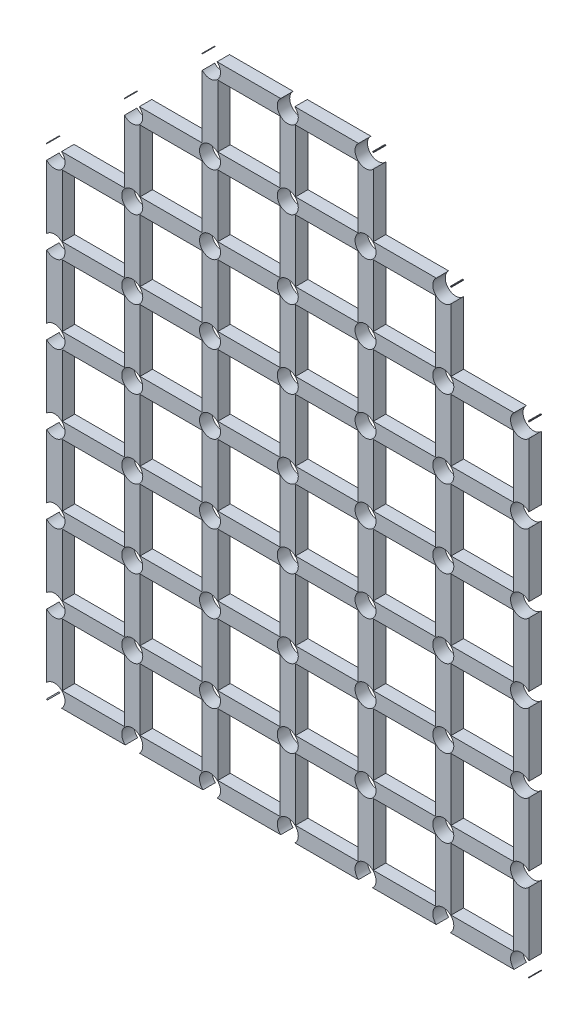
from build123d import *

# Parameters (mm, degrees)
SKETCH_1_W             = 15
SKETCH_1_H             = 0.5
EXTRUDE_1_DEPTH        = 0.4
PATTERN_LINEAR_1_COUNT = 7
PATTERN_LINEAR_1_PITCH = 2.5
EXTRUDE_3_DEPTH        = 0.4
PATTERN_LINEAR_2_COUNT = 7
PATTERN_LINEAR_2_PITCH = 2.5
SKETCH_4_W             = 0.5
SKETCH_4_H             = 2.5
EXTRUDE_4_DEPTH        = 0.4
SKETCH_6_W             = 0.5
SKETCH_6_H             = 2.5
EXTRUDE_6_DEPTH        = 0.4
SKETCH_7_W             = 10.5
SKETCH_7_H             = 0.5
SKETCH_7_W_2           = 5.5
EXTRUDE_7_DEPTH        = 0.4
OTHER_2_OUTLINE_R      = 0.3375
OTHER_2_DEPTH          = 0.4


# Read off the part's stored shape, not the designer's step: 型腔2
with BuildPart() as part:
    # 草图1 → 凸台-拉伸1 (new body)
    with BuildSketch(Plane.XY):
        with Locations((7.5, 0.25)):
            Rectangle(SKETCH_1_W, SKETCH_1_H)
    extrude(amount=EXTRUDE_1_DEPTH)


with BuildPart() as pattern_linear_1_1:
    # 阵列(线性)1: pattern copy
    add(part.part.moved(Location(Vector(0, 1, 0) * (1 * PATTERN_LINEAR_1_PITCH))))


with BuildPart() as pattern_linear_1_2:
    # 阵列(线性)1: pattern copy
    add(part.part.moved(Location(Vector(0, 1, 0) * (2 * PATTERN_LINEAR_1_PITCH))))


with BuildPart() as pattern_linear_1_3:
    # 阵列(线性)1: pattern copy
    add(part.part.moved(Location(Vector(0, 1, 0) * (3 * PATTERN_LINEAR_1_PITCH))))


with BuildPart() as pattern_linear_1_4:
    # 阵列(线性)1: pattern copy
    add(part.part.moved(Location(Vector(0, 1, 0) * (4 * PATTERN_LINEAR_1_PITCH))))


with BuildPart() as pattern_linear_1_5:
    # 阵列(线性)1: pattern copy
    add(part.part.moved(Location(Vector(0, 1, 0) * (5 * PATTERN_LINEAR_1_PITCH))))


with BuildPart() as pattern_linear_1_6:
    # 阵列(线性)1: pattern copy
    add(part.part.moved(Location(Vector(0, 1, 0) * (6 * PATTERN_LINEAR_1_PITCH))))


with BuildPart() as part_1:
    add(part.part)

    add(pattern_linear_1_1.part)  # 凸台-拉伸3 merges 阵列(线性)1_1

    add(pattern_linear_1_2.part)  # 凸台-拉伸3 merges 阵列(线性)1_2

    add(pattern_linear_1_3.part)  # 凸台-拉伸3 merges 阵列(线性)1_3
    # 草图3 → 凸台-拉伸3 (add)
    with BuildSketch(Plane.XY.offset(0.4)):
        Polygon((0, 15.5), (0, 8), (0, 0), (-0.5, 0), (-0.5, 10.98507125), (-0.5, 15.5), align=None)
    extrude_3 = extrude(amount=-EXTRUDE_3_DEPTH)

    # 阵列(线性)2: 凸台-拉伸3 ×7
    with Locations(*[(i * PATTERN_LINEAR_2_PITCH, 0, 0) for i in range(1, PATTERN_LINEAR_2_COUNT)]):
        add(extrude_3)

    add(pattern_linear_1_6.part)  # 凸台-拉伸4 merges 阵列(线性)1_6
    # 草图4 → 凸台-拉伸4 (add)
    with BuildSketch(Plane.XY.offset(0.4)):
        with Locations((4.75, 16.75)):
            Rectangle(SKETCH_4_W, SKETCH_4_H)
        with Locations((2.25, 16.75)):
            Rectangle(SKETCH_4_W, SKETCH_4_H)
        with Locations((7.25, 16.75)):
            Rectangle(SKETCH_4_W, SKETCH_4_H)
        with Locations((9.75, 16.75)):
            Rectangle(SKETCH_4_W, SKETCH_4_H)
        with Locations((12.25, 16.75)):
            Rectangle(SKETCH_4_W, SKETCH_4_H)
    extrude(amount=-EXTRUDE_4_DEPTH)

    # 草图6 → 凸台-拉伸6 (add)
    with BuildSketch(Plane.XY.offset(0.4)):
        with Locations((4.75, 19.25)):
            Rectangle(SKETCH_6_W, SKETCH_6_H)
        with Locations((9.75, 19.25)):
            Rectangle(SKETCH_6_W, SKETCH_6_H)
        with Locations((7.25, 19.25)):
            Rectangle(SKETCH_6_W, SKETCH_6_H)
    extrude(amount=-EXTRUDE_6_DEPTH)

    # 草图7 → 凸台-拉伸7 (add)
    with BuildSketch(Plane.XY.offset(0.4)):
        with Locations((7.25, 17.75)):
            Rectangle(SKETCH_7_W, SKETCH_7_H)
        with Locations((7.25, 20.25)):
            Rectangle(SKETCH_7_W_2, SKETCH_7_H)
    extrude(amount=-EXTRUDE_7_DEPTH)

    # Combine 1: union 阵列(线性)1_5, 阵列(线性)1_4
    add(pattern_linear_1_5.part)
    add(pattern_linear_1_4.part)

    # 型腔2 outline → 型腔2 (cut)
    with BuildSketch(Plane.XY):
        with BuildLine():
            ThreePointArc((9.523270536, 20.5), (9.511351461, 20.011351461), (10, 20.023270536))
            Line((10, 20.023270536), (10, 20.476729464))
            ThreePointArc((10, 20.476729464), (9.988648539, 20.488648539), (9.976729464, 20.5))
            Line((9.976729464, 20.5), (9.523270536, 20.5))
        make_face()
        with BuildLine():
            ThreePointArc((7.023270536, 20.5), (7.25, 19.9125), (7.476729464, 20.5))
            Line((7.476729464, 20.5), (7.023270536, 20.5))
        make_face()
        with BuildLine():
            Line((12.476729464, 18), (12.023270536, 18))
            ThreePointArc((12.023270536, 18), (12.011351461, 17.511351461), (12.5, 17.523270536))
            Line((12.5, 17.523270536), (12.5, 17.976729464))
            ThreePointArc((12.5, 17.976729464), (12.488648539, 17.988648539), (12.476729464, 18))
        make_face()
        with BuildLine():
            ThreePointArc((4.5, 20.023270536), (4.988648539, 20.011351461), (4.976729464, 20.5))
            Line((4.976729464, 20.5), (4.523270536, 20.5))
            ThreePointArc((4.523270536, 20.5), (4.511351461, 20.488648539), (4.5, 20.476729464))
            Line((4.5, 20.476729464), (4.5, 20.023270536))
        make_face()
        with BuildLine():
            Line((14.976729464, 15.5), (14.523270536, 15.5))
            ThreePointArc((14.523270536, 15.5), (14.511351461, 15.011351461), (15, 15.023270536))
            Line((15, 15.023270536), (15, 15.476729464))
            ThreePointArc((15, 15.476729464), (14.988648539, 15.488648539), (14.976729464, 15.5))
        make_face()
        with BuildLine():
            ThreePointArc((2, 17.523270536), (2.488648539, 17.511351461), (2.476729464, 18))
            Line((2.476729464, 18), (2.023270536, 18))
            ThreePointArc((2.023270536, 18), (2.011351461, 17.988648539), (2, 17.976729464))
            Line((2, 17.976729464), (2, 17.523270536))
        make_face()
        with BuildLine():
            Line((15, 12.523270536), (15, 12.976729464))
            ThreePointArc((15, 12.976729464), (14.4125, 12.75), (15, 12.523270536))
        make_face()
        with BuildLine():
            Line((15, 10.023270536), (15, 10.476729464))
            ThreePointArc((15, 10.476729464), (14.4125, 10.25), (15, 10.023270536))
        make_face()
        with BuildLine():
            ThreePointArc((-0.5, 15.023270536), (-0.011351461, 15.011351461), (-0.023270536, 15.5))
            Line((-0.023270536, 15.5), (-0.476729464, 15.5))
            ThreePointArc((-0.476729464, 15.5), (-0.488648539, 15.488648539), (-0.5, 15.476729464))
            Line((-0.5, 15.476729464), (-0.5, 15.023270536))
        make_face()
        with BuildLine():
            Line((15, 7.523270536), (15, 7.976729464))
            ThreePointArc((15, 7.976729464), (14.4125, 7.75), (15, 7.523270536))
        make_face()
        with BuildLine():
            ThreePointArc((-0.5, 12.523270536), (0.0875, 12.75), (-0.5, 12.976729464))
            Line((-0.5, 12.976729464), (-0.5, 12.523270536))
        make_face()
        with BuildLine():
            Line((15, 5.023270536), (15, 5.476729464))
            ThreePointArc((15, 5.476729464), (14.4125, 5.25), (15, 5.023270536))
        make_face()
        with BuildLine():
            ThreePointArc((-0.5, 10.023270536), (0.0875, 10.25), (-0.5, 10.476729464))
            Line((-0.5, 10.476729464), (-0.5, 10.023270536))
        make_face()
        with BuildLine():
            Line((15, 2.523270536), (15, 2.976729464))
            ThreePointArc((15, 2.976729464), (14.4125, 2.75), (15, 2.523270536))
        make_face()
        with BuildLine():
            ThreePointArc((-0.5, 7.523270536), (0.0875, 7.75), (-0.5, 7.976729464))
            Line((-0.5, 7.976729464), (-0.5, 7.523270536))
        make_face()
        with BuildLine():
            Line((15, 0.023270536), (15, 0.476729464))
            ThreePointArc((15, 0.476729464), (14.511351461, 0.488648539), (14.523270536, 0))
            Line((14.523270536, 0), (14.976729464, 0))
            ThreePointArc((14.976729464, 0), (14.988648539, 0.011351461), (15, 0.023270536))
        make_face()
        with BuildLine():
            ThreePointArc((-0.5, 5.023270536), (0.0875, 5.25), (-0.5, 5.476729464))
            Line((-0.5, 5.476729464), (-0.5, 5.023270536))
        make_face()
        with BuildLine():
            Line((12.023270536, 0), (12.476729464, 0))
            ThreePointArc((12.476729464, 0), (12.25, 0.5875), (12.023270536, 0))
        make_face()
        with BuildLine():
            ThreePointArc((-0.5, 2.523270536), (0.0875, 2.75), (-0.5, 2.976729464))
            Line((-0.5, 2.976729464), (-0.5, 2.523270536))
        make_face()
        with BuildLine():
            Line((9.523270536, 0), (9.976729464, 0))
            ThreePointArc((9.976729464, 0), (9.75, 0.5875), (9.523270536, 0))
        make_face()
        with BuildLine():
            ThreePointArc((-0.023270536, 0), (-0.011351461, 0.488648539), (-0.5, 0.476729464))
            Line((-0.5, 0.476729464), (-0.5, 0.023270536))
            ThreePointArc((-0.5, 0.023270536), (-0.488648539, 0.011351461), (-0.476729464, 0))
            Line((-0.476729464, 0), (-0.023270536, 0))
        make_face()
        with BuildLine():
            Line((7.023270536, 0), (7.476729464, 0))
            ThreePointArc((7.476729464, 0), (7.25, 0.5875), (7.023270536, 0))
        make_face()
        with BuildLine():
            ThreePointArc((2.476729464, 0), (2.25, 0.5875), (2.023270536, 0))
            Line((2.023270536, 0), (2.476729464, 0))
        make_face()
        with BuildLine():
            Line((4.523270536, 0), (4.976729464, 0))
            ThreePointArc((4.976729464, 0), (4.75, 0.5875), (4.523270536, 0))
        make_face()
        with Locations((12.25, 5.25)):
            Circle(OTHER_2_OUTLINE_R)
        with Locations((12.25, 7.75)):
            Circle(OTHER_2_OUTLINE_R)
        with Locations((12.25, 10.25)):
            Circle(OTHER_2_OUTLINE_R)
        with Locations((12.25, 12.75)):
            Circle(OTHER_2_OUTLINE_R)
        with Locations((12.25, 15.25)):
            Circle(OTHER_2_OUTLINE_R)
        with Locations((9.75, 5.25)):
            Circle(OTHER_2_OUTLINE_R)
        with Locations((9.75, 7.75)):
            Circle(OTHER_2_OUTLINE_R)
        with Locations((9.75, 10.25)):
            Circle(OTHER_2_OUTLINE_R)
        with Locations((9.75, 12.75)):
            Circle(OTHER_2_OUTLINE_R)
        with Locations((9.75, 15.25)):
            Circle(OTHER_2_OUTLINE_R)
        with Locations((9.75, 17.75)):
            Circle(OTHER_2_OUTLINE_R)
        with Locations((12.25, 2.75)):
            Circle(OTHER_2_OUTLINE_R)
        with Locations((2.25, 5.25)):
            Circle(OTHER_2_OUTLINE_R)
        with Locations((2.25, 7.75)):
            Circle(OTHER_2_OUTLINE_R)
        with Locations((2.25, 10.25)):
            Circle(OTHER_2_OUTLINE_R)
        with Locations((2.25, 12.75)):
            Circle(OTHER_2_OUTLINE_R)
        with Locations((2.25, 15.25)):
            Circle(OTHER_2_OUTLINE_R)
        with Locations((4.75, 2.75)):
            Circle(OTHER_2_OUTLINE_R)
        with Locations((2.25, 2.75)):
            Circle(OTHER_2_OUTLINE_R)
        with Locations((7.25, 5.25)):
            Circle(OTHER_2_OUTLINE_R)
        with Locations((7.25, 7.75)):
            Circle(OTHER_2_OUTLINE_R)
        with Locations((7.25, 10.25)):
            Circle(OTHER_2_OUTLINE_R)
        with Locations((7.25, 12.75)):
            Circle(OTHER_2_OUTLINE_R)
        with Locations((7.25, 15.25)):
            Circle(OTHER_2_OUTLINE_R)
        with Locations((7.25, 17.75)):
            Circle(OTHER_2_OUTLINE_R)
        with Locations((9.75, 2.75)):
            Circle(OTHER_2_OUTLINE_R)
        with Locations((4.75, 5.25)):
            Circle(OTHER_2_OUTLINE_R)
        with Locations((4.75, 7.75)):
            Circle(OTHER_2_OUTLINE_R)
        with Locations((4.75, 10.25)):
            Circle(OTHER_2_OUTLINE_R)
        with Locations((4.75, 12.75)):
            Circle(OTHER_2_OUTLINE_R)
        with Locations((4.75, 15.25)):
            Circle(OTHER_2_OUTLINE_R)
        with Locations((4.75, 17.75)):
            Circle(OTHER_2_OUTLINE_R)
        with Locations((7.25, 2.75)):
            Circle(OTHER_2_OUTLINE_R)
    extrude(amount=OTHER_2_DEPTH, mode=Mode.SUBTRACT)


solid = part_1.part
